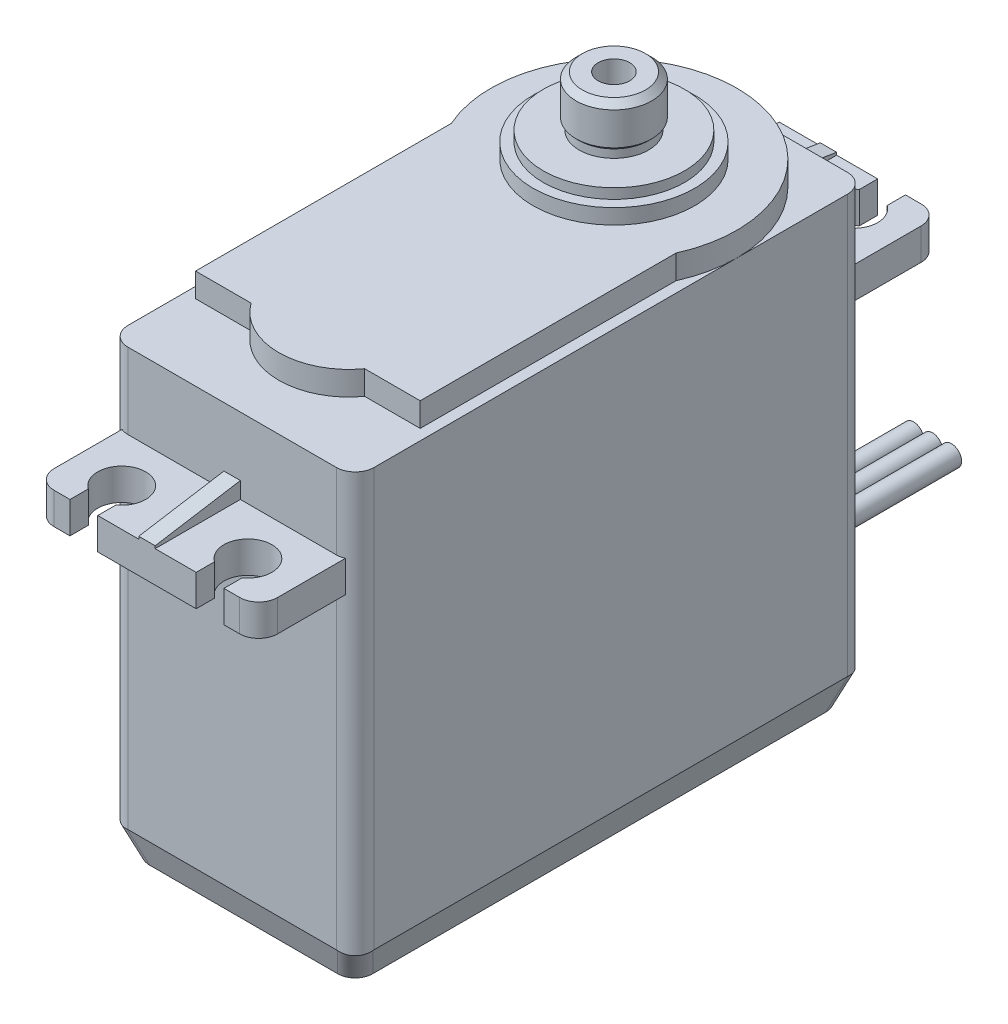
from build123d import *
from OCP.BRepFilletAPI import BRepFilletAPI_MakeChamfer

# Parameters (mm, degrees)
SKETCH2_W                 = 19.5
SKETCH2_H                 = 40.5
BOSS_EXTRUDE1_DEPTH       = 17.8
CHAMFER1_SIZE             = 2.5
CHAMFER1_SIZE2            = 0.909925586
FILLET1_R                 = 1.5
BOSS_EXTRUDE2_START       = -6
SKETCH3_W                 = 17.7
SKETCH3_H                 = 54
BOSS_EXTRUDE2_DEPTH       = 2.5
FILLET2_R                 = 1.5
BOSS_EXTRUDE3_DEPTH       = 0.65
BOSS_EXTRUDE4_DEPTH       = 1.9
SKETCH6_R                 = 6.4
BOSS_EXTRUDE5_DEPTH       = 1.2
SKETCH7_R                 = 5.6
BOSS_EXTRUDE6_DEPTH       = 0.8
SKETCH8_R                 = 2.75
BOSS_EXTRUDE7_DEPTH       = 4
SKETCH9_R                 = 3
BOSS_EXTRUDE8_DEPTH       = 3.4
CHAMFER2_SIZE             = 0.3
CHAMFER3_SIZE             = 0.5
CUT_EXTRUDE1_REACH        = 43.234
MIRROR3_COPY_1_REACH      = 43.234
SKETCH12_W                = 6.8
SKETCH12_H                = 4
BOSS_EXTRUDE9_DEPTH       = 0.8
SKETCH13_W                = 6.4
SKETCH13_H                = 3.6
BOSS_EXTRUDE10_DEPTH      = 4.2
BOSS_EXTRUDE10_TAPER      = 3
BOSS_EXTRUDE11_DEPTH      = 10
M3X0_5_TAPPED_HOLE1_D     = 2.5
M3X0_5_TAPPED_HOLE1_DEPTH = 6
M3X0_5_TAPPED_HOLE1_TIP   = 0.751075774


with BuildPart() as part:
    # Sketch2 → Boss-Extrude1 (new, symmetric)
    with BuildSketch(Plane(origin=(0, 0, 0), x_dir=(1, 0, 0), z_dir=(0, 1, 0))):
        Rectangle(SKETCH2_W, SKETCH2_H)
    extrude(amount=BOSS_EXTRUDE1_DEPTH, both=True)

    # Chamfer1: one chamfer whose edges measure the first distance from different faces: ONE call of the kernel's chamfer builder (chamfer() names one face for all edges)
    chamfer1_edges_1 = [part.edges().sort_by_distance(p)[0] for p in [
        (0, -17.8, -20.25),
    ]]
    chamfer1_side_1 = [part.faces().sort_by_distance(p)[0] for p in [
        (0, 0, -20.25),
    ]]
    chamfer1_edges_2 = [part.edges().sort_by_distance(p)[0] for p in [
        (9.75, -17.8, 0),
    ]]
    chamfer1_side_2 = [part.faces().sort_by_distance(p)[0] for p in [
        (9.75, 0, 0),
    ]]
    chamfer1_edges_3 = [part.edges().sort_by_distance(p)[0] for p in [
        (0, -17.8, 20.25),
    ]]
    chamfer1_side_3 = [part.faces().sort_by_distance(p)[0] for p in [
        (0, 0, 20.25),
    ]]
    chamfer1_edges_4 = [part.edges().sort_by_distance(p)[0] for p in [
        (-9.75, -17.8, 0),
    ]]
    chamfer1_side_4 = [part.faces().sort_by_distance(p)[0] for p in [
        (-9.75, 0, 0),
    ]]
    chamfer1 = BRepFilletAPI_MakeChamfer(part.part.solid().wrapped)
    for e in chamfer1_edges_1:
        chamfer1.Add(CHAMFER1_SIZE, CHAMFER1_SIZE2, e.wrapped, chamfer1_side_1[0].wrapped)  # the first distance lies on this face
    for e in chamfer1_edges_2:
        chamfer1.Add(CHAMFER1_SIZE, CHAMFER1_SIZE2, e.wrapped, chamfer1_side_2[0].wrapped)  # the first distance lies on this face
    for e in chamfer1_edges_3:
        chamfer1.Add(CHAMFER1_SIZE, CHAMFER1_SIZE2, e.wrapped, chamfer1_side_3[0].wrapped)  # the first distance lies on this face
    for e in chamfer1_edges_4:
        chamfer1.Add(CHAMFER1_SIZE, CHAMFER1_SIZE2, e.wrapped, chamfer1_side_4[0].wrapped)  # the first distance lies on this face
    add(Compound.cast(chamfer1.Shape()), mode=Mode.REPLACE)

    # Fillet1
    # the kernel refuses this fillet: 1.5 mm, written as the material it takes off along each edge
    with BuildSketch(Plane(origin=(-10.829006934, -12.335452813, -21.329006934), x_dir=(0.9461886483394649, 0.3040991697893321, -0.11068304606838018), z_dir=(0.3236155771181854, -0.8891264907159878, 0.32361557711818534)), Plane(origin=(-10.829006934, -12.335452813, 21.329006934), x_dir=(-0.1106830460683806, 0.30409916978933194, -0.946188648339465), z_dir=(0.32361557711818534, -0.8891264907159879, -0.3236155771181854))) as fillet1_piece_1:
        with BuildLine():
            CenterArc((FILLET1_R * 0.889126490716, FILLET1_R), FILLET1_R, 186.717713464, 83.282286536)
            Line((-FILLET1_R * 0.104008041637, FILLET1_R * 0.883022221559), (0, 0))
            Line((0, 0), (FILLET1_R * 0.889126490716, 0))
        make_face()
    extrude(amount=9.480197094, mode=Mode.SUBTRACT)
    with BuildSketch(Plane(origin=(10.829006934, -12.335452813, -21.329006934), x_dir=(-0.946188648339465, 0.30409916978933194, -0.1106830460683806), z_dir=(-0.3236155771181854, -0.8891264907159879, 0.3236155771181854)), Plane(origin=(10.829006934, -12.335452813, 21.329006934), x_dir=(0.11068304606838136, 0.3040991697893317, -0.9461886483394651), z_dir=(-0.3236155771181854, -0.8891264907159879, -0.3236155771181854))) as fillet1_piece_2:
        with BuildLine():
            CenterArc((FILLET1_R * 0.889126490716, -FILLET1_R), FILLET1_R, 90, 83.282286536)
            Line((-FILLET1_R * 0.104008041637, -FILLET1_R * 0.883022221559), (0, 0))
            Line((0, 0), (FILLET1_R * 0.889126490716, 0))
        make_face()
    extrude(amount=9.480197094, mode=Mode.SUBTRACT)
    with BuildSketch(Plane(origin=(-9.75, -19.05, -20.25), x_dir=(1, 0, 0), z_dir=(0, 1, 0)), Plane(origin=(9.75, 21.55, -20.25), x_dir=(-1, 0, 0), z_dir=(0, -1, 0)), Plane(origin=(9.75, 21.55, 20.25), x_dir=(0, 0, -1), z_dir=(0, -1, 0)), Plane(origin=(-9.75, -19.05, 20.25), x_dir=(0, 0, -1), z_dir=(0, 1, 0))) as fillet1_piece_3:
        with BuildLine():
            CenterArc((FILLET1_R, -FILLET1_R), FILLET1_R, 90, 90)
            Line((0, -FILLET1_R), (0, 0))
            Line((0, 0), (FILLET1_R, 0))
        make_face()
    extrude(amount=40.6, mode=Mode.SUBTRACT)

    # Sketch3 → Boss-Extrude2 (add)
    with BuildSketch(Plane(origin=(0, 17.8, 0), x_dir=(1, 0, 0), z_dir=(0, 1, 0)).offset(BOSS_EXTRUDE2_START)):
        Rectangle(SKETCH3_W, SKETCH3_H)
    extrude(amount=-BOSS_EXTRUDE2_DEPTH)

    # Fillet2
    fillet2_edges = [part.edges().sort_by_distance(p)[0] for p in [
        (-8.85, 10.55, 27),
        (8.85, 10.55, -27),
        (-8.85, 10.55, -27),
        (8.85, 10.55, 27),
    ]]
    fillet(fillet2_edges, radius=FILLET2_R)

    # Sketch4 → Boss-Extrude3 (add, symmetric)
    with BuildSketch(Plane(origin=(0, 0, 0), x_dir=(0, 0, -1), z_dir=(1, 0, 0))):
        Polygon((-20.25, 11.8), (-27, 11.8), (-27, 12), (-20.25, 13.1), align=None)
    boss_extrude3 = extrude(amount=BOSS_EXTRUDE3_DEPTH, both=True)

    # Mirror1: Boss-Extrude3 across plane
    add(boss_extrude3.mirror(Plane.XY))

    # Sketch5 → Boss-Extrude4 (add)
    with BuildSketch(Plane(origin=(0, 17.8, 0), x_dir=(1, 0, 0), z_dir=(0, 1, 0))):
        with BuildLine():
            Line((-8.9, 6.01848019), (-8.9, -14.25))
            Line((-8.9, -14.25), (-4.5, -14.25))
            ThreePointArc((-4.5, -14.25), (0, -16.55), (4.5, -14.25))
            Line((4.5, -14.25), (8.9, -14.25))
            Line((8.9, -14.25), (8.9, 6.01848019))
            ThreePointArc((8.9, 6.01848019), (0, 19.75), (-8.9, 6.01848019))
        make_face()
    extrude(amount=BOSS_EXTRUDE4_DEPTH)

    # Sketch6 → Boss-Extrude5 (add)
    with BuildSketch(Plane(origin=(0, 19.7, 0), x_dir=(1, 0, 0), z_dir=(0, 1, 0))):
        with Locations(Location((0, 10, 0), (0, 0, 270))):
            Circle(SKETCH6_R)
    extrude(amount=BOSS_EXTRUDE5_DEPTH)

    # Sketch7 → Boss-Extrude6 (add)
    with BuildSketch(Plane(origin=(0, 20.9, 0), x_dir=(1, 0, 0), z_dir=(0, 1, 0))):
        with Locations(Location((0, 10, 0), (0, 0, 270))):
            Circle(SKETCH7_R)
    extrude(amount=BOSS_EXTRUDE6_DEPTH)

    # Sketch8 → Boss-Extrude7 (add)
    with BuildSketch(Plane(origin=(0, 21.7, 0), x_dir=(1, 0, 0), z_dir=(0, 1, 0))):
        with Locations(Location((0, 10, 0), (0, 0, 270))):
            Circle(SKETCH8_R)
    extrude(amount=BOSS_EXTRUDE7_DEPTH)

    # Sketch9 → Boss-Extrude8 (add)
    with BuildSketch(Plane(origin=(0, 25.7, 0), x_dir=(1, 0, 0), z_dir=(0, 1, 0))):
        with Locations(Location((0, 10, 0), (0, 0, 270))):
            Circle(SKETCH9_R)
    extrude(amount=-BOSS_EXTRUDE8_DEPTH)

    # Chamfer2
    # the kernel refuses this chamfer: 0.3 mm, written as the material it takes off along each edge
    with BuildSketch(Plane(origin=(0, 22.3, -10), x_dir=(0, 0, 1), z_dir=(-1, 0, 0))) as chamfer2_piece_1_section:
        Polygon((3 - CHAMFER2_SIZE, 0), (3, CHAMFER2_SIZE), (3, 0), align=None)
    chamfer2_piece_1 = revolve(axis=Axis((0, 22.3, -10), (0, 1, 0)), mode=Mode.PRIVATE)
    chamfer2_piece_1 = chamfer2_piece_1 - Plane(origin=(0, 22.47249354, -10), x_dir=(0, 0, 1), z_dir=(0, -1, 0)) * Cylinder(2.75, 12, mode=Mode.PRIVATE)
    add(chamfer2_piece_1, mode=Mode.SUBTRACT)

    # Chamfer3
    chamfer3_edges = [part.edges().sort_by_distance(p)[0] for p in [
        (0, 25.7, -13),
    ]]
    chamfer(chamfer3_edges, length=CHAMFER3_SIZE)

    # Sketch11 → Cut-Extrude1 (cut, up to next)
    with BuildSketch(Plane(origin=(0, 11.8, 0), x_dir=(1, 0, 0), z_dir=(0, 1, 0)), mode=Mode.PRIVATE) as cut_extrude1_sk1:
        with BuildLine():
            Line((6.1, -27), (3.9, -27))
            Line((3.9, -27), (3.9, -25.549193338))
            ThreePointArc((3.9, -25.549193338), (5, -22.1), (6.1, -25.549193338))
            Line((6.1, -25.549193338), (6.1, -27))
        make_face()
    cut_extrude1_tool1 = extrude(cut_extrude1_sk1.sketch, amount=-CUT_EXTRUDE1_REACH, mode=Mode.PRIVATE) & part.part
    cut_extrude1 = cut_extrude1_tool1.solids().sort_by_distance((5, 11.8, 24.454928))[0]
    add(cut_extrude1, mode=Mode.SUBTRACT)

    # Mirror2: Cut-Extrude1 across plane
    add(cut_extrude1.mirror(Plane(origin=(0, 0, 0), x_dir=(0, 0, 1), z_dir=(1, 0, 0))), mode=Mode.SUBTRACT)

    # Mirror3: Cut-Extrude1 across plane
    add(cut_extrude1.mirror(Plane.XY), mode=Mode.SUBTRACT)

    # Mirror3 copy 1 sketch → Mirror3 copy 1 (cut, up to next)
    with BuildSketch(Plane(origin=(0, 11.8, 0), x_dir=(-1, 0, 0), z_dir=(0, 1, 0)), mode=Mode.PRIVATE) as mirror3_copy_1_sk1:
        with BuildLine():
            Line((6.1, -27), (3.9, -27))
            Line((3.9, -27), (3.9, -25.549193338))
            ThreePointArc((3.9, -25.549193338), (5, -22.1), (6.1, -25.549193338))
            Line((6.1, -25.549193338), (6.1, -27))
        make_face()
    mirror3_copy_1_tool1 = extrude(mirror3_copy_1_sk1.sketch, amount=-MIRROR3_COPY_1_REACH, mode=Mode.PRIVATE) & part.part
    add(mirror3_copy_1_tool1.solids().sort_by_distance((-5, 11.8, -24.454928))[0], mode=Mode.SUBTRACT)

    # Sketch12 → Boss-Extrude9 (add)
    with BuildSketch(Plane.XY.offset(-20.25)):
        with Locations((0, -12.5)):
            Rectangle(SKETCH12_W, SKETCH12_H)
    extrude(amount=-BOSS_EXTRUDE9_DEPTH)

    # Sketch13 → Boss-Extrude10 (add)
    with BuildSketch(Plane(origin=(0, 0, -21.05), x_dir=(-1, 0, 0), z_dir=(0, 0, -1))):
        with Locations((0, -12.5)):
            Rectangle(SKETCH13_W, SKETCH13_H)
    extrude(amount=BOSS_EXTRUDE10_DEPTH, taper=BOSS_EXTRUDE10_TAPER)

    # Sketch14 → Boss-Extrude11 (add)
    with BuildSketch(Plane(origin=(0, 0, -25.25), x_dir=(-1, 0, 0), z_dir=(0, 0, -1))):
        with BuildLine():
            ThreePointArc((0.75, -12.778388218), (2.3, -12.5), (0.75, -12.221611782))
            ThreePointArc((0.75, -12.221611782), (0, -11.7), (-0.75, -12.221611782))
            ThreePointArc((-0.75, -12.221611782), (-2.3, -12.5), (-0.75, -12.778388218))
            ThreePointArc((-0.75, -12.778388218), (0, -13.3), (0.75, -12.778388218))
        make_face()
    extrude(amount=BOSS_EXTRUDE11_DEPTH)

    # M3x0.5 Tapped Hole1
    with Locations(Plane(origin=(0, 25.7, 0), x_dir=(1, 0, 0), z_dir=(0, 1, 0))):
        with Locations((0, 10)):
            Hole(M3X0_5_TAPPED_HOLE1_D / 2, depth=M3X0_5_TAPPED_HOLE1_DEPTH)
            with Locations((0, 0, -(M3X0_5_TAPPED_HOLE1_DEPTH + M3X0_5_TAPPED_HOLE1_TIP / 2))):  # 118° drill point
                Cone(0, M3X0_5_TAPPED_HOLE1_D / 2, M3X0_5_TAPPED_HOLE1_TIP, mode=Mode.SUBTRACT)


solid = part.part
